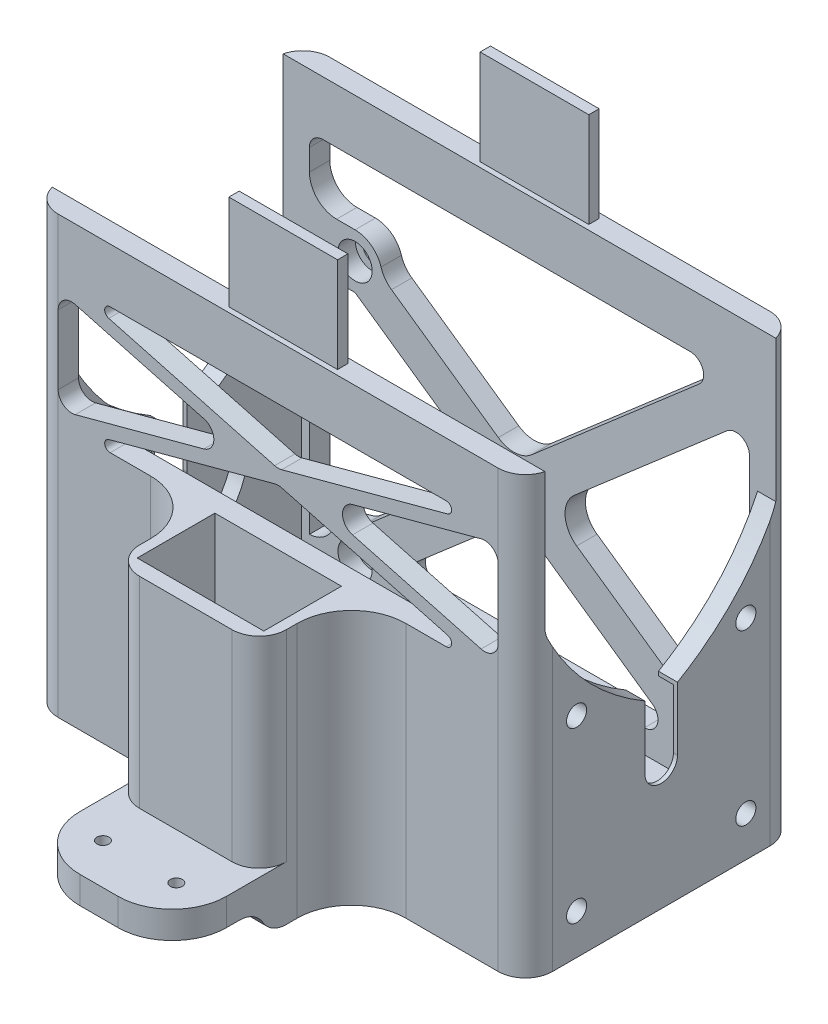
from build123d import *

# Parameters (mm, degrees)
BOSS_EXTRU_1_DEPTH       = 84
ESQUISSE6_W              = 27
ESQUISSE6_H              = 47
BOSS_EXTRU_3_DEPTH       = 17
ESQUISSE7_W              = 23.3
ESQUISSE7_H              = 14.3
ENL_V_MAT_EXTRU_4_DEPTH  = 43.3
ESQUISSE8_R              = 1.85
BOSS_EXTRU_4_DEPTH       = 3.5
ESQUISSE12_R             = 11.275
ENL_V_MAT_EXTRU_7_DEPTH  = 2.75
ESQUISSE13_W             = 27
ESQUISSE13_H             = 10
BOSS_EXTRU_5_DEPTH       = 16
ESQUISSE15_W             = 27
ESQUISSE15_H             = 22.5
ENL_V_MAT_EXTRU_9_DEPTH  = 5
ESQUISSE14_R             = 1.11
ENL_V_MAT_EXTRU_8_DEPTH  = 15
CONG_6_R                 = 5
CONG_7_R                 = 5
CONG_1_R                 = 10
CONG_3_R                 = 10
CONG_4_R                 = 5
CONG_8_R                 = 5
ESQUISSE22_W             = 84
ESQUISSE22_H             = 42.5
ENL_V_MAT_EXTRU_12_DEPTH = 1
CONG_12_R                = 5
ESQUISSE20_R             = 1.7
ENL_V_MAT_EXTRU_13_DEPTH = 10
ESQUISSE23_R             = 3.15
ENL_V_MAT_EXTRU_14_DEPTH = 3.2
ESQUISSE24_W             = 20
ESQUISSE24_H             = 1.9
BOSS_EXTRU_6_DEPTH       = 17.5
CONG_13_R                = 5
ENL_V_MAT_EXTRU_15_DEPTH = 10
CONG_14_R                = 5
CONG_15_R                = 5
CONG_16_R                = 2.5
CONG_17_START            = -30.407704032
CONG_17_DEPTH            = 3.75
ENL_V_MAT_EXTRU_17_DEPTH = 10
CONG_18_R                = 2.5
CONG_19_R                = 1


with BuildPart() as part:
    # Esquisse1 → Boss.-Extru.1 (new body)
    with BuildSketch(Plane(origin=(0, 0, 0), x_dir=(0, 0, -1), z_dir=(1, 0, 0))):
        Polygon((-15.842295968, 13.667406166), (-15.842295968, -28.832593834), (26.657704032, -28.832593834), (26.657704032, 13.667406166), (26.657704032, 48.667406166), (30.407704032, 48.667406166), (30.407704032, 13.667406166), (30.407704032, -31.582593834), (-19.592295968, -31.582593834), (-19.592295968, 14.341554225), (-19.592295968, 48.667406166), (-15.842295968, 48.667406166), align=None)
    extrude(amount=BOSS_EXTRU_1_DEPTH)

    # Esquisse6 → Boss.-Extru.3 (add)
    with BuildSketch(Plane.XY.offset(19.592295968)):
        with Locations((42, -8.082593834)):
            Rectangle(ESQUISSE6_W, ESQUISSE6_H)
    extrude(amount=BOSS_EXTRU_3_DEPTH)

    # Esquisse7 → Enlèv. mat.-Extru.4 (cut)
    with BuildSketch(Plane(origin=(0, 15.417406166, 0), x_dir=(1, 0, 0), z_dir=(0, 1, 0))):
        with Locations((42, -26.742295968)):
            Rectangle(ESQUISSE7_W, ESQUISSE7_H)
    extrude(amount=-ENL_V_MAT_EXTRU_4_DEPTH, mode=Mode.SUBTRACT)

    # Esquisse8 → Boss.-Extru.4 (add)
    with BuildSketch(Plane(origin=(84, 0, 0), x_dir=(0, 0, -1), z_dir=(1, 0, 0))):
        with BuildLine():
            Line((-19.592295968, -31.582593834), (30.407704032, -31.582593834))
            Line((30.407704032, -31.582593834), (30.407704032, 13.667406166))
            Line((30.407704032, 13.667406166), (30.407704032, 33.667406166))
            Line((30.407704032, 33.667406166), (30.407704032, 48.667406166))
            Line((30.407704032, 48.667406166), (26.657704032, 48.667406166))
            Line((26.657704032, 48.667406166), (26.657704032, 33.667406166))
            Line((26.657704032, 33.667406166), (26.657704032, 22.620772795))
            add(Edge.make_bspline(
                [(26.657704032, 22.620772795), (22.743346217, 14.429233991), (16.660012883, 7.903111781), (8.407704032, 3.042406166)],
                knots=[0.29307205, 0.29307205, 0.29307205, 0.29307205, 1, 1, 1, 1], degree=3))
            Line((8.407704032, 3.042406166), (8.407704032, -7.582593834))
            Line((8.407704032, -7.582593834), (8.407704032, -8.582593834))
            ThreePointArc((8.407704032, -8.582593834), (5.407704032, -11.582593834), (2.407704032, -8.582593834))
            Line((2.407704032, -8.582593834), (2.407704032, -7.582593834))
            Line((2.407704032, -7.582593834), (2.407704032, 3.042406166))
            add(Edge.make_bspline(
                [(-15.842295968, 22.620772795), (-11.927938152, 14.429233991), (-5.844604818, 7.903111781), (2.407704032, 3.042406166)],
                knots=[0.29307205, 0.29307205, 0.29307205, 0.29307205, 1, 1, 1, 1], degree=3))
            Line((-15.842295968, 22.620772795), (-15.842295968, 48.667406166))
            Line((-15.842295968, 48.667406166), (-19.592295968, 48.667406166))
            Line((-19.592295968, 48.667406166), (-19.592295968, 28.667406166))
            Line((-19.592295968, 28.667406166), (-19.592295968, 13.667406166))
            Line((-19.592295968, 13.667406166), (-19.592295968, -31.582593834))
        make_face()
        with Locations((-10.167295968, 6.992406166)):
            Circle(ESQUISSE8_R, mode=Mode.SUBTRACT)
        with Locations((20.982704032, 6.992406166)):
            Circle(ESQUISSE8_R, mode=Mode.SUBTRACT)
        with Locations((20.982704032, -24.157593834)):
            Circle(ESQUISSE8_R, mode=Mode.SUBTRACT)
        with Locations((-10.167295968, -24.157593834)):
            Circle(ESQUISSE8_R, mode=Mode.SUBTRACT)
    boss_extru_4 = extrude(amount=BOSS_EXTRU_4_DEPTH)

    # Esquisse12 → Enlèv. mat.-Extru.7 (cut)
    with BuildSketch(Plane.ZY.offset(-84)):
        with Locations((-5.407704032, -8.582593834)):
            Circle(ESQUISSE12_R)
    enl_v_mat_extru_7 = extrude(amount=-ENL_V_MAT_EXTRU_7_DEPTH, mode=Mode.SUBTRACT)

    # Symétrie1: Boss.-Extru.4, Enlèv. mat.-Extru.7 across plane
    add(boss_extru_4.mirror(Plane.ZY.offset(-42)))
    add(enl_v_mat_extru_7.mirror(Plane.ZY.offset(-42)), mode=Mode.SUBTRACT)

    # Esquisse13 → Boss.-Extru.5 (add)
    with BuildSketch(Plane.XY.offset(36.592295968)):
        with Locations((42, -26.582593834)):
            Rectangle(ESQUISSE13_W, ESQUISSE13_H)
    extrude(amount=BOSS_EXTRU_5_DEPTH)

    # Esquisse15 → Enlèv. mat.-Extru.9 (cut)
    with BuildSketch(Plane.XZ.offset(31.582593834)):
        with Locations((42, 47.842295968)):
            Rectangle(ESQUISSE15_W, ESQUISSE15_H)
    extrude(amount=-ENL_V_MAT_EXTRU_9_DEPTH, mode=Mode.SUBTRACT)

    # Esquisse14 → Enlèv. mat.-Extru.8 (cut)
    with BuildSketch(Plane.XZ.offset(31.582593834)):
        with Locations(Location((35.25, 45.092295968, 0), (0, 0, 270))):
            Circle(ESQUISSE14_R)
        with Locations(Location((48.75, 45.092295968, 0), (0, 0, 270))):
            Circle(ESQUISSE14_R)
    extrude(amount=-ENL_V_MAT_EXTRU_8_DEPTH, mode=Mode.SUBTRACT)

    # Congé6
    cong_6_edges = [part.edges().sort_by_distance(p)[0] for p in [
        (42, -31.582593834, 36.592295968),
    ]]
    fillet(cong_6_edges, radius=CONG_6_R - 0.0001)  # a hair under: the kernel refuses the full size

    # Congé7
    cong_7_edges = [part.edges().sort_by_distance(p)[0] for p in [
        (42, -26.582593834, 36.592295968),
    ]]
    fillet(cong_7_edges, radius=CONG_7_R)

    # Congé1
    cong_1_edges = [part.edges().sort_by_distance(p)[0] for p in [
        (28.5, -24.082593834, 52.592295968),
        (55.5, -24.082593834, 52.592295968),
    ]]
    fillet(cong_1_edges, radius=CONG_1_R)

    # Congé3
    cong_3_edges = [part.edges().sort_by_distance(p)[0] for p in [
        (28.5, -8.082593834, 19.592295968),
        (55.5, -8.082593834, 19.592295968),
    ]]
    fillet(cong_3_edges, radius=CONG_3_R)

    # Congé4
    cong_4_edges = [part.edges().sort_by_distance(p)[0] for p in [
        (-3.5, 8.542406166, 19.592295968),
        (87.5, 8.542406166, 19.592295968),
    ]]
    fillet(cong_4_edges, radius=CONG_4_R)

    # Congé8
    cong_8_edges = [part.edges().sort_by_distance(p)[0] for p in [
        (55.5, -3.082593834, 36.592295968),
        (28.5, -3.082593834, 36.592295968),
    ]]
    fillet(cong_8_edges, radius=CONG_8_R)

    # Esquisse22 → Enlèv. mat.-Extru.12 (cut)
    with BuildSketch(Plane(origin=(0, -28.832593834, 0), x_dir=(1, 0, 0), z_dir=(0, 1, 0))):
        with Locations((42, 5.407704032)):
            Rectangle(ESQUISSE22_W, ESQUISSE22_H)
    extrude(amount=-ENL_V_MAT_EXTRU_12_DEPTH, mode=Mode.SUBTRACT)

    # Congé12
    cong_12_edges = [part.edges().sort_by_distance(p)[0] for p in [
        (-3.5, 8.542406166, -30.407704032),
        (87.5, 8.542406166, -30.407704032),
    ]]
    fillet(cong_12_edges, radius=CONG_12_R)

    # Esquisse20 → Enlèv. mat.-Extru.13 (cut)
    with BuildSketch(Plane(origin=(0, 0, -30.407704032), x_dir=(-1, 0, 0), z_dir=(0, 0, -1))):
        with Locations((-9.901603848, 22.230835003)):
            Circle(ESQUISSE20_R)
        with Locations((-9.901603848, -25.519164997)):
            Circle(ESQUISSE20_R)
        with Locations((-76.102103848, -25.519164997)):
            Circle(ESQUISSE20_R)
    extrude(amount=-ENL_V_MAT_EXTRU_13_DEPTH, mode=Mode.SUBTRACT)

    # Esquisse23 → Enlèv. mat.-Extru.14 (cut)
    with BuildSketch(Plane.XY.offset(-26.657704032)):
        with Locations((9.901603848, 22.230835003)):
            Circle(ESQUISSE23_R)
        with Locations((9.901603848, -25.519164997)):
            Circle(ESQUISSE23_R)
        with Locations((76.102103848, -25.519164997)):
            Circle(ESQUISSE23_R)
    extrude(amount=-ENL_V_MAT_EXTRU_14_DEPTH, mode=Mode.SUBTRACT)

    # Esquisse24 → Boss.-Extru.6 (add)
    with BuildSketch(Plane(origin=(0, 48.667406166, 0), x_dir=(1, 0, 0), z_dir=(0, 1, 0))):
        with Locations((42, 28.532704032)):
            Rectangle(ESQUISSE24_W, ESQUISSE24_H)
        with Locations((42, -17.717295968)):
            Rectangle(ESQUISSE24_W, ESQUISSE24_H)
    extrude(amount=BOSS_EXTRU_6_DEPTH)

    # Congé13
    cong_13_edges = [part.edges().sort_by_distance(p)[0] for p in [
        (-1.670614591, 22.620772795, 15.842295968),
        (85.670614591, 22.620772795, 15.842295968),
    ]]
    fillet(cong_13_edges, radius=CONG_13_R)

    # Esquisse25 → Enlèv. mat.-Extru.15 (cut)
    with BuildSketch(Plane(origin=(0, 0, -30.407704032), x_dir=(-1, 0, 0), z_dir=(0, 0, -1))):
        with BuildLine():
            Line((-1.5, 36.793850774), (-1.5, 27.230835003))
            Line((-1.5, 27.230835003), (-9.901603848, 27.230835003))
            ThreePointArc((-9.901603848, 27.230835003), (-13.437137754, 25.766368909), (-14.901603848, 22.230835003))
            Line((-14.901603848, 22.230835003), (-39.463341251, 5.073879194))
            Line((-39.463341251, 5.073879194), (-76.102103848, 36.793850774))
            Line((-76.102103848, 36.793850774), (-78.266189999, 38.667406166))
            Line((-78.266189999, 38.667406166), (-1.5, 38.667406166))
            Line((-1.5, 38.667406166), (-1.5, 36.793850774))
        make_face()
        with BuildLine():
            Line((-1.5, -25.519164997), (-4.901603848, -25.519164997))
            ThreePointArc((-4.901603848, -25.519164997), (-6.366069942, -21.983631091), (-9.901603848, -20.519164997))
            Line((-9.901603848, -20.519164997), (-34.034224849, 0.373627173))
            Line((-34.034224849, 0.373627173), (-9.901603848, 17.230835003))
            Line((-9.901603848, 17.230835003), (-1.5, 17.230835003))
            Line((-1.5, 17.230835003), (-1.5, -25.519164997))
        make_face()
        with BuildLine():
            Line((-82.5, 33.004077951), (-82.5, -25.519164997))
            Line((-82.5, -25.519164997), (-81.102103848, -25.519164997))
            ThreePointArc((-81.102103848, -25.519164997), (-79.637637754, -21.983631091), (-76.102103848, -20.519164997))
            Line((-76.102103848, -20.519164997), (-45.426972134, 0.908141655))
            Line((-45.426972134, 0.908141655), (-82.5, 33.004077951))
        make_face()
        Polygon((-14.901603848, -25.519164997), (-71.102103848, -25.519164997), (-39.997855733, -3.792110366), align=None)
    extrude(amount=-ENL_V_MAT_EXTRU_15_DEPTH, mode=Mode.SUBTRACT)

    # Congé14
    # the kernel refuses this fillet: 5 mm, written as the material it adds along each edge
    with BuildSketch(Plane(origin=(1.5, 27.230835003, -30.407704032), x_dir=(0, 1, 0), z_dir=(0, 0, 1))) as cong_14_piece_1:
        with BuildLine():
            CenterArc((CONG_14_R, -CONG_14_R), CONG_14_R, 90, 90)
            Line((0, -CONG_14_R), (-CONG_14_R * 0.02, -CONG_14_R))
            Line((-CONG_14_R * 0.02, -CONG_14_R), (-CONG_14_R * 0.02, CONG_14_R * 0.02))
            Line((-CONG_14_R * 0.02, CONG_14_R * 0.02), (CONG_14_R, CONG_14_R * 0.02))
            Line((CONG_14_R, CONG_14_R * 0.02), (CONG_14_R, 0))
        make_face()
    extrude(amount=3.75)
    with BuildSketch(Plane(origin=(81.102103848, -25.519164997, -30.407704032), x_dir=(1, 0, 0), z_dir=(0, 0, 1))) as cong_14_piece_2:
        with BuildLine():
            CenterArc((4.06024984, 4.232242059), CONG_14_R, 205.038313096, 32.789141799)
            Line((-0.46987508, 2.116121029), (-0.560477579, 2.073798609))
            ThreePointArc((-0.560477579, 2.073798609), (-0.216504423, 1.062153505), (-0.1, 0))
            Line((-0.1, 0), (0, -0.1))
            ThreePointArc((0, -0.1), (0.698948076, -0.1), (1.344649078, -0.084644841))
            Line((1.344649078, -0.084644841), (1.397896152, 0))
        make_face()
    extrude(amount=3.75)
    with BuildSketch(Plane(origin=(4.901603848, -25.519164997, -30.407704032), x_dir=(0.25843418738578255, 0.9660288664373597, 0), z_dir=(0, 0, 1))) as cong_14_piece_3:
        with BuildLine():
            CenterArc((3.876512811, 4.830144332), CONG_14_R, 197.988094325, 57.034733046)
            Line((-0.879090726, 3.286047509), (-0.974202797, 3.255165573))
            ThreePointArc((-0.974202797, 3.255165573), (-0.53614825, 1.617180336), (-0.096602887, -0.025843419))
            Line((-0.096602887, -0.025843419), (0.025843419, -0.096602887))
            ThreePointArc((0.025843419, -0.096602887), (1.292170937, 0.069855668), (2.558498455, -0.096602887))
            Line((2.558498455, -0.096602887), (2.584341874, 0))
        make_face()
    extrude(amount=3.75)
    with BuildSketch(Plane(origin=(9.901603848, -20.519164997, -30.407704032), x_dir=(0.7560323551220743, 0.6545342450999564, 0), z_dir=(0, 0, 1))) as cong_14_piece_4:
        with BuildLine():
            CenterArc((1.513638333, 5), CONG_14_R, 241.403974296, 28.596025704)
            Line((-0.879516446, 0.609919112), (-0.927379542, 0.522117494))
            ThreePointArc((-0.927379542, 0.522117494), (-0.480376844, 0.246386633), (-0.065453425, -0.075603236))
            Line((-0.065453425, -0.075603236), (0, -0.1))
            Line((0, -0.1), (1.513638333, -0.1))
            Line((1.513638333, -0.1), (1.513638333, 0))
        make_face()
    extrude(amount=3.75)
    with BuildSketch(Plane(origin=(76.102103848, -20.519164997, -30.407704032), x_dir=(0.9958632105710886, -0.0908650968801752, 0), z_dir=(0, 0, 1))) as cong_14_piece_5:
        with BuildLine():
            CenterArc((1.362976453, 4.979316053), CONG_14_R, 240.278165384, 24.508457194)
            Line((-1.115971825, 0.637102858), (-1.165550791, 0.550258594))
            Line((-1.165550791, 0.550258594), (-0.049578966, -0.086844264))
            Line((-0.049578966, -0.086844264), (0.00908651, -0.099586321))
            ThreePointArc((0.00908651, -0.099586321), (0.454325484, -0.079316053), (0.899564459, -0.099586321))
            Line((0.899564459, -0.099586321), (0.908650969, 0))
        make_face()
    extrude(amount=3.75)
    with BuildSketch(Plane(origin=(14.901603848, 22.230835003, -30.407704032), x_dir=(0.8198000996074954, -0.5726498028320106, 0), z_dir=(0, 0, 1))) as cong_14_piece_6:
        with BuildLine():
            CenterArc((2.079131496, 5), CONG_14_R, 231.843382021, 38.156617979)
            Line((-1.009934501, 1.068375493), (-1.071715821, 0.989743003))
            ThreePointArc((-1.071715821, 0.989743003), (-0.53815576, 0.502814674), (-0.08198001, -0.05726498))
            Line((-0.08198001, -0.05726498), (0, -0.1))
            Line((0, -0.1), (2.079131496, -0.1))
            Line((2.079131496, -0.1), (2.079131496, 0))
        make_face()
    extrude(amount=3.75)

    # Congé15
    cong_15_edges = [part.edges().sort_by_distance(p)[0] for p in [
        (45.426972134, 0.908141655, -28.532704032),
        (39.997855733, -3.792110366, -28.532704032),
        (34.034224849, 0.373627173, -28.532704032),
        (39.463341251, 5.073879194, -28.532704032),
    ]]
    fillet(cong_15_edges, radius=CONG_15_R)

    # Congé16
    cong_16_edges = [part.edges().sort_by_distance(p)[0] for p in [
        (82.5, 33.004077951, -28.532704032),
        (14.901603848, -25.519164997, -28.532704032),
        (71.102103848, -25.519164997, -28.532704032),
        (78.266189999, 38.667406166, -28.532704032),
        (1.5, 38.667406166, -28.532704032),
    ]]
    fillet(cong_16_edges, radius=CONG_16_R)

    # Congé17: read off the stored shape, not the designer's step
    # Congé17 outline → Congé17 (add)
    with BuildSketch(Plane.XY.offset(CONG_17_START)):
        with BuildLine():
            Line((82.5, -25.519164997), (82.5, -19.111637737))
            ThreePointArc((82.5, -19.111637737), (81.225102691, -21.290886093), (78.700701283, -21.247480157))
            ThreePointArc((78.700701283, -21.247480157), (79.82584987, -22.182442719), (80.632228768, -23.403043968))
            ThreePointArc((80.632228768, -23.403043968), (81.413696704, -24.595634292), (82.5, -25.519164997))
        make_face()
    extrude(amount=CONG_17_DEPTH)

    # Esquisse26 → Enlèv. mat.-Extru.17 (cut)
    with BuildSketch(Plane.XY.offset(19.592295968)):
        Polygon((3.5, 38.667406166), (80.5, 38.667406166), (42, 28.311393508), align=None)
        Polygon((1.5, 36.667406166), (1.5, 17.417406166), (37.282352941, 27.042406166), align=None)
        Polygon((3.5, 15.417406166), (80.5, 15.417406166), (42, 25.773418824), align=None)
        Polygon((82.5, 36.667406166), (82.5, 17.417406166), (46.717647059, 27.042406166), align=None)
    extrude(amount=-ENL_V_MAT_EXTRU_17_DEPTH, mode=Mode.SUBTRACT)

    # Congé18
    cong_18_edges = [part.edges().sort_by_distance(p)[0] for p in [
        (82.5, 17.417406166, 17.717295968),
        (46.717647059, 27.042406166, 17.717295968),
        (82.5, 36.667406166, 17.717295968),
        (1.5, 36.667406166, 17.717295968),
        (37.282352941, 27.042406166, 17.717295968),
        (1.5, 17.417406166, 17.717295968),
        (42, 25.773418824, 17.717295968),
        (42, 28.311393508, 17.717295968),
    ]]
    fillet(cong_18_edges, radius=CONG_18_R)

    # Congé19
    cong_19_edges = [part.edges().sort_by_distance(p)[0] for p in [
        (3.5, 15.417406166, 17.717295968),
        (80.5, 15.417406166, 17.717295968),
        (3.5, 38.667406166, 17.717295968),
        (80.5, 38.667406166, 17.717295968),
    ]]
    fillet(cong_19_edges, radius=CONG_19_R)


solid = part.part
